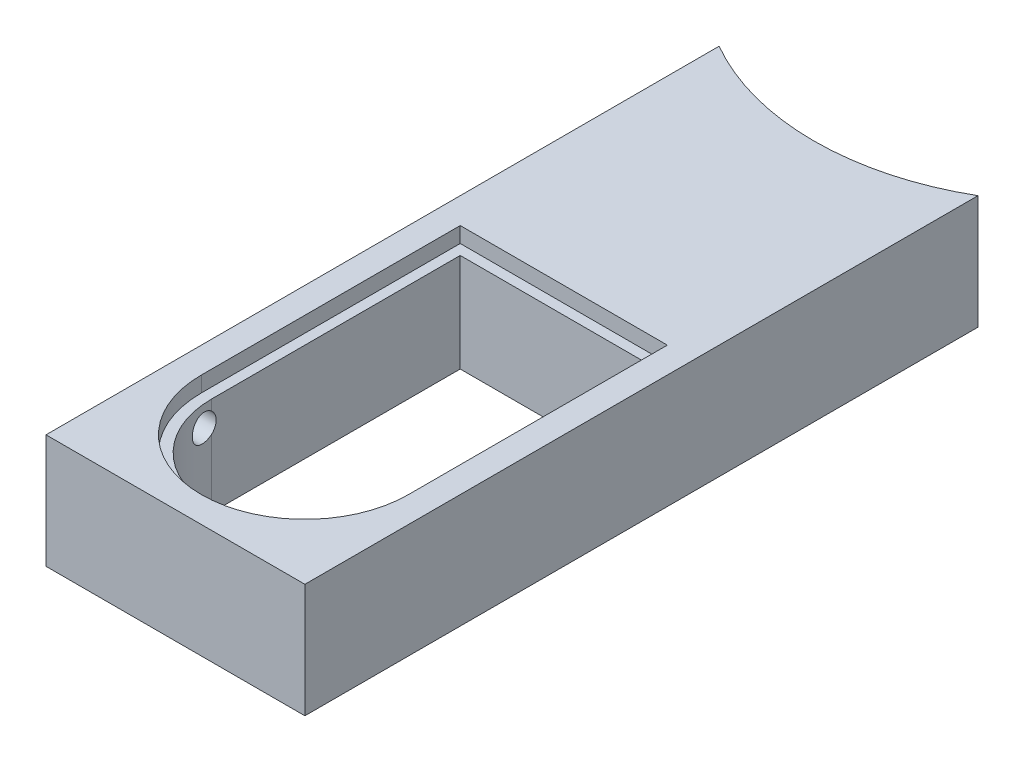
from build123d import *

# Parameters (mm, degrees)
EXTRUDE_1_DEPTH          = 10
SKETCH_2_R               = 8
CUT_EXTRUDE_1_DEPTH      = 10
EXTRUDE_START            = -1.2
SKETCH_4_R               = 8
EXTRUDE_2_DEPTH          = 1.2
CUT_EXTRUDE_4_DEPTH      = 8.8
EXTRUDE_START_2          = 1.2
EXTRUDE_3_DEPTH          = 7.6
SKETCH_6_W               = 0.8
SKETCH_6_H               = 0.8
CUT_EXTRUDE_5_DEPTH      = 0.8
CUT_EXTRUDE_6_DEPTH      = 1.2
SKETCH_8_W               = 1.6
SKETCH_8_H               = 0.8
EXTRUDE_4_DEPTH          = 0.8
HOLE_WIZARD_M2_5_2_D     = 2.05
HOLE_WIZARD_M2_5_2_DEPTH = 10
HOLE_WIZARD_M2_5_2_TIP   = 0.615882135


# Read off the part's stored shape, not the designer's step: 填料-伸長3
with BuildPart() as part:
    # 草圖1 → 填料-伸長1 (new body)
    with BuildSketch(Plane(origin=(0, 0, 0), x_dir=(1, 0, 0), z_dir=(0, 1, 0))):
        with BuildLine():
            ThreePointArc((0, -20), (-5.176380902, -19.318516526), (-10, -17.320508076))
            Line((-10, -17.320508076), (-10, -69.320508076))
            Line((-10, -69.320508076), (10, -69.320508076))
            Line((10, -69.320508076), (10, -17.320508076))
            ThreePointArc((10, -17.320508076), (5.176380902, -19.318516526), (0, -20))
        make_face()
    extrude(amount=EXTRUDE_1_DEPTH)

    # 草圖2 → 除料-伸長1 (cut)
    with BuildSketch(Plane(origin=(0, 10, 0), x_dir=(1, 0, 0), z_dir=(0, 1, 0))):
        with Locations(Location((0, -59.320508076, 0), (0, 0, 270))):
            Circle(SKETCH_2_R)
    extrude(amount=-CUT_EXTRUDE_1_DEPTH, mode=Mode.SUBTRACT)

    # 草圖4 → 填料-伸長2 (add)
    with BuildSketch(Plane.XZ.offset(EXTRUDE_START)):
        with Locations(Location((0, 59.320508076, 0), (0, 0, 90))):
            Circle(SKETCH_4_R)
    extrude(amount=EXTRUDE_2_DEPTH)

    # 草圖5 → 除料-伸長4 (cut)
    with BuildSketch(Plane(origin=(0, 10, 0), x_dir=(1, 0, 0), z_dir=(0, 1, 0))):
        with BuildLine():
            Line((-8, -39.320508076), (-8, -59.320508076))
            ThreePointArc((-8, -59.320508076), (0, -51.320508076), (8, -59.320508076))
            Line((8, -59.320508076), (8, -39.320508076))
            Line((8, -39.320508076), (-8, -39.320508076))
        make_face()
    extrude(amount=-CUT_EXTRUDE_4_DEPTH, mode=Mode.SUBTRACT)

    # 填料-伸長3 outline → 填料-伸長3 (add)
    with BuildSketch(Plane(origin=(0, 0, 0), x_dir=(1, 0, 0), z_dir=(0, 1, 0)).offset(EXTRUDE_START_2)):
        with BuildLine():
            Line((-8, -39.320508076), (-8, -59.320508076))
            ThreePointArc((-8, -59.320508076), (0, -67.320508076), (8, -59.320508076))
            Line((8, -59.320508076), (8, -39.320508076))
            Line((8, -39.320508076), (-8, -39.320508076))
        make_face()
        with BuildLine():
            ThreePointArc((7.2, -59.320508076), (0, -66.520508076), (-7.2, -59.320508076))
            Line((-7.2, -59.320508076), (-7.2, -40.120508076))
            Line((-7.2, -40.120508076), (7.2, -40.120508076))
            Line((7.2, -40.120508076), (7.2, -59.320508076))
        make_face(mode=Mode.SUBTRACT)
    extrude(amount=EXTRUDE_3_DEPTH)

    # 草圖6 → 除料-伸長5 (cut)
    with BuildSketch(Plane(origin=(0, 10, 0), x_dir=(1, 0, 0), z_dir=(0, 1, 0))):
        with Locations((0.4, -38.920508076)):
            Rectangle(SKETCH_6_W, SKETCH_6_H)
        with Locations((-0.4, -38.920508076)):
            Rectangle(SKETCH_6_W, SKETCH_6_H)
    extrude(amount=-CUT_EXTRUDE_5_DEPTH, mode=Mode.SUBTRACT)

    # 草圖7 → 除料-伸長6 (cut)
    with BuildSketch(Plane.XZ):
        with BuildLine():
            Line((10, 69.320508076), (10, 17.320508076))
            ThreePointArc((10, 17.320508076), (0, 20), (-10, 17.320508076))
            Line((-10, 17.320508076), (-10, 69.320508076))
            Line((-10, 69.320508076), (10, 69.320508076))
        make_face()
    extrude(amount=-CUT_EXTRUDE_6_DEPTH, mode=Mode.SUBTRACT)

    # 草圖8 → 填料-伸長4 (add)
    with BuildSketch(Plane(origin=(0, 10, 0), x_dir=(1, 0, 0), z_dir=(0, 1, 0))):
        with Locations((0, -38.920508076)):
            Rectangle(SKETCH_8_W, SKETCH_8_H)
    extrude(amount=-EXTRUDE_4_DEPTH)

    # M2.5  螺絲攻的螺孔鑽2
    with Locations(Plane(origin=(-10, 7.214577241, 60), x_dir=(0, 0, -1), z_dir=(-1, 0, 0))):
        with Locations((0, 0)):
            Hole(HOLE_WIZARD_M2_5_2_D / 2, depth=HOLE_WIZARD_M2_5_2_DEPTH)
            with Locations((0, 0, -(HOLE_WIZARD_M2_5_2_DEPTH + HOLE_WIZARD_M2_5_2_TIP / 2))):  # 118° drill point
                Cone(0, HOLE_WIZARD_M2_5_2_D / 2, HOLE_WIZARD_M2_5_2_TIP, mode=Mode.SUBTRACT)


solid = part.part
